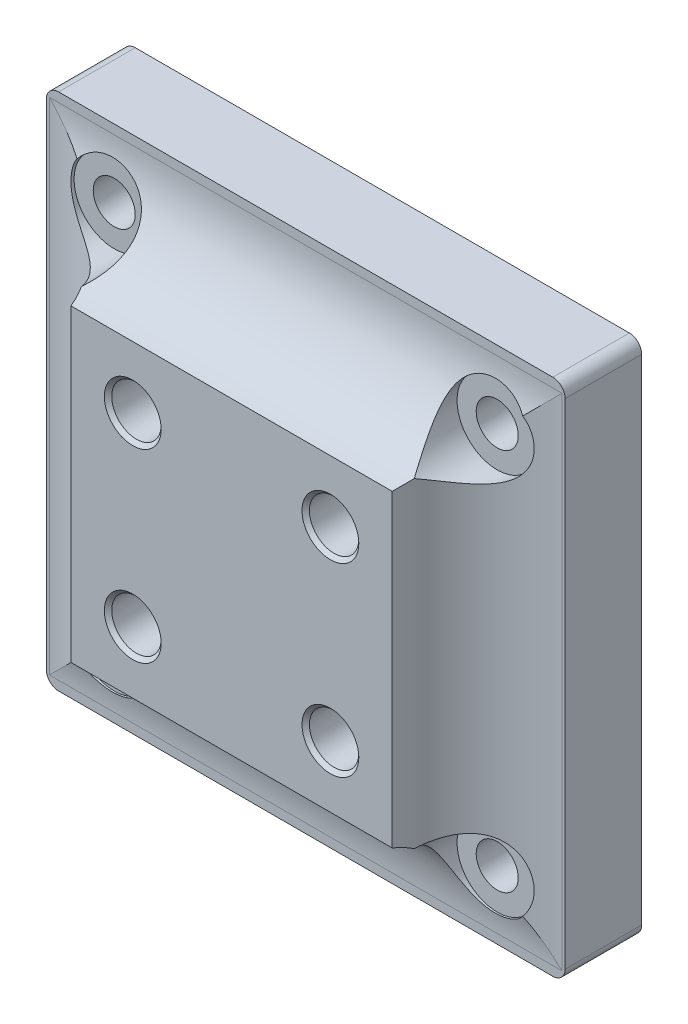
from build123d import *

# Parameters (mm, degrees)
SKETCH1_W           = 42
SKETCH1_H           = 42
SKETCH1_R           = 1.7
SKETCH1_R_2         = 3
BOSS_EXTRUDE1_DEPTH = 6.2
SKETCH2_W           = 26
SKETCH2_H           = 25
SKETCH2_R           = 2
BOSS_EXTRUDE2_DEPTH = 6
FILLET2_R           = 8
SKETCH3_R           = 3.25
CUT_EXTRUDE1_DEPTH  = 6
CHAMFER1_SIZE       = 0.3
FILLET3_R           = 1


with BuildPart() as part:
    # Sketch1 → Boss-Extrude1 (new body)
    with BuildSketch(Plane.XY):
        with Locations((21, 21)):
            Rectangle(SKETCH1_W, SKETCH1_H)
        with Locations(Location((5.5, 5.5, 0), (0, 0, 180))):
            Circle(SKETCH1_R, mode=Mode.SUBTRACT)
        with Locations(Location((36.5, 5.5, 0), (0, 0, 180))):
            Circle(SKETCH1_R, mode=Mode.SUBTRACT)
        with Locations(Location((36.5, 36.5, 0), (0, 0, 180))):
            Circle(SKETCH1_R, mode=Mode.SUBTRACT)
        with Locations(Location((5.5, 36.5, 0), (0, 0, 180))):
            Circle(SKETCH1_R, mode=Mode.SUBTRACT)
        with Locations(Location((13, 13.5, 0), (0, 0, 180))):
            Circle(SKETCH1_R_2, mode=Mode.SUBTRACT)
        with Locations(Location((29, 13.5, 0), (0, 0, 180))):
            Circle(SKETCH1_R_2, mode=Mode.SUBTRACT)
        with Locations(Location((29, 28.5, 0), (0, 0, 180))):
            Circle(SKETCH1_R_2, mode=Mode.SUBTRACT)
        with Locations(Location((13, 28.5, 0), (0, 0, 180))):
            Circle(SKETCH1_R_2, mode=Mode.SUBTRACT)
    extrude(amount=BOSS_EXTRUDE1_DEPTH)

    # Sketch2 → Boss-Extrude2 (add)
    with BuildSketch(Plane.XY.offset(6.2)):
        with Locations((21, 21)):
            Rectangle(SKETCH2_W, SKETCH2_H)
        with Locations((13, 13.5)):
            Circle(SKETCH2_R, mode=Mode.SUBTRACT)
        with Locations((29, 13.5)):
            Circle(SKETCH2_R, mode=Mode.SUBTRACT)
        with Locations((29, 28.5)):
            Circle(SKETCH2_R, mode=Mode.SUBTRACT)
        with Locations((13, 28.5)):
            Circle(SKETCH2_R, mode=Mode.SUBTRACT)
    extrude(amount=BOSS_EXTRUDE2_DEPTH)

    # Fillet2
    # the kernel refuses this fillet: 8 mm, written as the material it adds along each edge
    with BuildSketch(Plane(origin=(8, 33.5, 6.2), x_dir=(0, 1, 0), z_dir=(1, 0, 0)), Plane(origin=(34, 8.5, 6.2), x_dir=(0, -1, 0), z_dir=(-1, 0, 0))) as fillet2_piece_1:
        with BuildLine():
            CenterArc((7.745966692, 8), FILLET2_R, 194.477512186, 75.522487814)
            Line((0, 6), (-0.154919334, 5.96))
            ThreePointArc((-0.154919334, 5.96), (-0.16, 3), (-0.16, 0))
            Line((-0.16, 0), (0, -0.16))
            Line((0, -0.16), (7.745966692, -0.16))
            Line((7.745966692, -0.16), (7.745966692, 0))
        make_face()
    extrude(amount=26)
    with BuildSketch(Plane(origin=(8, 8.5, 6.2), x_dir=(-1, 0, 0), z_dir=(0, 1, 0)), Plane(origin=(34, 33.5, 6.2), x_dir=(1, 0, 0), z_dir=(0, -1, 0))) as fillet2_piece_2:
        with BuildLine():
            CenterArc((7.745966692, 8), FILLET2_R, 194.477512186, 75.522487814)
            Line((0, 6), (-0.154919334, 5.96))
            ThreePointArc((-0.154919334, 5.96), (-0.16, 3), (-0.16, 0))
            Line((-0.16, 0), (0, -0.16))
            Line((0, -0.16), (7.745966692, -0.16))
            Line((7.745966692, -0.16), (7.745966692, 0))
        make_face()
    extrude(amount=25)
    with BuildSketch(Plane(origin=(-11.364916731, 33.5, 6.2), x_dir=(0, 1, 0), z_dir=(1, 0, 0))) as fillet2_piece_3a_section:
        with BuildLine():
            CenterArc((7.745966692, 8), FILLET2_R, 194.477512186, 75.522487814)
            Line((0, 6), (-0.154919334, 5.96))
            ThreePointArc((-0.154919334, 5.96), (-0.16, 3), (-0.16, 0))
            Line((-0.16, 0), (0, -0.16))
            Line((0, -0.16), (7.745966692, -0.16))
            Line((7.745966692, -0.16), (7.745966692, 0))
        make_face()
    fillet2_piece_3a = extrude(amount=45.364916731, mode=Mode.PRIVATE)
    fillet2_piece_3a = split(fillet2_piece_3a, bisect_by=Plane(origin=(0, 35.178274385, 7.827030576), z_dir=(1, 0, 0)), keep=Keep.TOP, mode=Mode.PRIVATE)
    fillet2_piece_3a = fillet2_piece_3a - Plane(origin=(5.5, 36.5, 7.827030576), x_dir=(-1, 0, 0), z_dir=(0, 0, -1)) * Cylinder(1.7, 122, mode=Mode.PRIVATE)
    fillet2_piece_3a = split(fillet2_piece_3a, bisect_by=Plane(origin=(8, 35.178274385, 7.827030576), z_dir=(-1, 0, 0)), keep=Keep.TOP, mode=Mode.PRIVATE)
    with BuildSketch(Plane(origin=(8, 8.5, 6.2), x_dir=(-1, 0, 0), z_dir=(0, 1, 0))) as fillet2_piece_3b_section:
        with BuildLine():
            CenterArc((7.745966692, 8), FILLET2_R, 194.477512186, 75.522487814)
            Line((0, 6), (-0.154919334, 5.96))
            ThreePointArc((-0.154919334, 5.96), (-0.16, 3), (-0.16, 0))
            Line((-0.16, 0), (0, -0.16))
            Line((0, -0.16), (7.745966692, -0.16))
            Line((7.745966692, -0.16), (7.745966692, 0))
        make_face()
    fillet2_piece_3b = extrude(amount=44.364916731, mode=Mode.PRIVATE)
    fillet2_piece_3b = split(fillet2_piece_3b, bisect_by=Plane(origin=(2.007562064, 42, 6.346846355), z_dir=(0, -1, 0)), keep=Keep.TOP, mode=Mode.PRIVATE)
    fillet2_piece_3b = fillet2_piece_3b - Plane(origin=(5.5, 36.5, 6.346846355), x_dir=(-1, 0, 0), z_dir=(0, 0, -1)) * Cylinder(1.7, 120, mode=Mode.PRIVATE)
    fillet2_piece_3b = split(fillet2_piece_3b, bisect_by=Plane(origin=(2.007562064, 33.5, 6.346846355), z_dir=(0, 1, 0)), keep=Keep.TOP, mode=Mode.PRIVATE)
    fillet2_piece_3 = fillet2_piece_3a & fillet2_piece_3b
    add(fillet2_piece_3)
    with BuildSketch(Plane(origin=(34, 52.864916731, 6.2), x_dir=(1, 0, 0), z_dir=(0, -1, 0))) as fillet2_piece_4a_section:
        with BuildLine():
            CenterArc((7.745966692, 8), FILLET2_R, 194.477512186, 75.522487814)
            Line((0, 6), (-0.154919334, 5.96))
            ThreePointArc((-0.154919334, 5.96), (-0.16, 3), (-0.16, 0))
            Line((-0.16, 0), (0, -0.16))
            Line((0, -0.16), (7.745966692, -0.16))
            Line((7.745966692, -0.16), (7.745966692, 0))
        make_face()
    fillet2_piece_4a = extrude(amount=44.364916731, mode=Mode.PRIVATE)
    fillet2_piece_4a = split(fillet2_piece_4a, bisect_by=Plane(origin=(39.992437924, 42, 6.3468463), z_dir=(0, -1, 0)), keep=Keep.TOP, mode=Mode.PRIVATE)
    fillet2_piece_4a = fillet2_piece_4a - Plane(origin=(36.5, 36.5, 6.3468463), x_dir=(-1, 0, 0), z_dir=(0, 0, -1)) * Cylinder(1.7, 120, mode=Mode.PRIVATE)
    fillet2_piece_4a = split(fillet2_piece_4a, bisect_by=Plane(origin=(39.992437924, 33.5, 6.3468463), z_dir=(0, 1, 0)), keep=Keep.TOP, mode=Mode.PRIVATE)
    with BuildSketch(Plane(origin=(8, 33.5, 6.2), x_dir=(0, 1, 0), z_dir=(1, 0, 0))) as fillet2_piece_4b_section:
        with BuildLine():
            CenterArc((7.745966692, 8), FILLET2_R, 194.477512186, 75.522487814)
            Line((0, 6), (-0.154919334, 5.96))
            ThreePointArc((-0.154919334, 5.96), (-0.16, 3), (-0.16, 0))
            Line((-0.16, 0), (0, -0.16))
            Line((0, -0.16), (7.745966692, -0.16))
            Line((7.745966692, -0.16), (7.745966692, 0))
        make_face()
    fillet2_piece_4b = extrude(amount=45.364916731, mode=Mode.PRIVATE)
    fillet2_piece_4b = split(fillet2_piece_4b, bisect_by=Plane(origin=(42, 35.178274622, 7.827030822), z_dir=(-1, 0, 0)), keep=Keep.TOP, mode=Mode.PRIVATE)
    fillet2_piece_4b = fillet2_piece_4b - Plane(origin=(36.5, 36.5, 7.827030822), x_dir=(-1, 0, 0), z_dir=(0, 0, -1)) * Cylinder(1.7, 122, mode=Mode.PRIVATE)
    fillet2_piece_4b = split(fillet2_piece_4b, bisect_by=Plane(origin=(34, 35.178274622, 7.827030822), z_dir=(1, 0, 0)), keep=Keep.TOP, mode=Mode.PRIVATE)
    fillet2_piece_4 = fillet2_piece_4a & fillet2_piece_4b
    add(fillet2_piece_4)
    with BuildSketch(Plane(origin=(34, 8.5, 6.2), x_dir=(0, -1, 0), z_dir=(-1, 0, 0))) as fillet2_piece_5a_section:
        with BuildLine():
            CenterArc((7.745966692, 8), FILLET2_R, 194.477512186, 75.522487814)
            Line((0, 6), (-0.154919334, 5.96))
            ThreePointArc((-0.154919334, 5.96), (-0.16, 3), (-0.16, 0))
            Line((-0.16, 0), (0, -0.16))
            Line((0, -0.16), (7.745966692, -0.16))
            Line((7.745966692, -0.16), (7.745966692, 0))
        make_face()
    fillet2_piece_5a = extrude(amount=45.364916731, mode=Mode.PRIVATE)
    fillet2_piece_5a = split(fillet2_piece_5a, bisect_by=Plane(origin=(0, 6.821719635, 7.827028702), z_dir=(1, 0, 0)), keep=Keep.TOP, mode=Mode.PRIVATE)
    fillet2_piece_5a = fillet2_piece_5a - Plane(origin=(5.5, 5.5, 7.827028702), x_dir=(-1, 0, 0), z_dir=(0, 0, -1)) * Cylinder(1.7, 122, mode=Mode.PRIVATE)
    fillet2_piece_5a = split(fillet2_piece_5a, bisect_by=Plane(origin=(8, 6.821719635, 7.827028702), z_dir=(-1, 0, 0)), keep=Keep.TOP, mode=Mode.PRIVATE)
    with BuildSketch(Plane(origin=(8, -10.864916731, 6.2), x_dir=(-1, 0, 0), z_dir=(0, 1, 0))) as fillet2_piece_5b_section:
        with BuildLine():
            CenterArc((7.745966692, 8), FILLET2_R, 194.477512186, 75.522487814)
            Line((0, 6), (-0.154919334, 5.96))
            ThreePointArc((-0.154919334, 5.96), (-0.16, 3), (-0.16, 0))
            Line((-0.16, 0), (0, -0.16))
            Line((0, -0.16), (7.745966692, -0.16))
            Line((7.745966692, -0.16), (7.745966692, 0))
        make_face()
    fillet2_piece_5b = extrude(amount=44.364916731, mode=Mode.PRIVATE)
    fillet2_piece_5b = split(fillet2_piece_5b, bisect_by=Plane(origin=(2.007562075, 0, 6.346846306), z_dir=(0, 1, 0)), keep=Keep.TOP, mode=Mode.PRIVATE)
    fillet2_piece_5b = fillet2_piece_5b - Plane(origin=(5.5, 5.5, 6.346846306), x_dir=(-1, 0, 0), z_dir=(0, 0, -1)) * Cylinder(1.7, 120, mode=Mode.PRIVATE)
    fillet2_piece_5b = split(fillet2_piece_5b, bisect_by=Plane(origin=(2.007562075, 8.5, 6.346846306), z_dir=(0, -1, 0)), keep=Keep.TOP, mode=Mode.PRIVATE)
    fillet2_piece_5 = fillet2_piece_5a & fillet2_piece_5b
    add(fillet2_piece_5)
    with BuildSketch(Plane(origin=(53.364916731, 8.5, 6.2), x_dir=(0, -1, 0), z_dir=(-1, 0, 0))) as fillet2_piece_6a_section:
        with BuildLine():
            CenterArc((7.745966692, 8), FILLET2_R, 194.477512186, 75.522487814)
            Line((0, 6), (-0.154919334, 5.96))
            ThreePointArc((-0.154919334, 5.96), (-0.16, 3), (-0.16, 0))
            Line((-0.16, 0), (0, -0.16))
            Line((0, -0.16), (7.745966692, -0.16))
            Line((7.745966692, -0.16), (7.745966692, 0))
        make_face()
    fillet2_piece_6a = extrude(amount=45.364916731, mode=Mode.PRIVATE)
    fillet2_piece_6a = split(fillet2_piece_6a, bisect_by=Plane(origin=(42, 6.821719176, 7.827028974), z_dir=(-1, 0, 0)), keep=Keep.TOP, mode=Mode.PRIVATE)
    fillet2_piece_6a = fillet2_piece_6a - Plane(origin=(36.5, 5.5, 7.827028974), x_dir=(-1, 0, 0), z_dir=(0, 0, -1)) * Cylinder(1.7, 122, mode=Mode.PRIVATE)
    fillet2_piece_6a = split(fillet2_piece_6a, bisect_by=Plane(origin=(34, 6.821719176, 7.827028974), z_dir=(1, 0, 0)), keep=Keep.TOP, mode=Mode.PRIVATE)
    with BuildSketch(Plane(origin=(34, 33.5, 6.2), x_dir=(1, 0, 0), z_dir=(0, -1, 0))) as fillet2_piece_6b_section:
        with BuildLine():
            CenterArc((7.745966692, 8), FILLET2_R, 194.477512186, 75.522487814)
            Line((0, 6), (-0.154919334, 5.96))
            ThreePointArc((-0.154919334, 5.96), (-0.16, 3), (-0.16, 0))
            Line((-0.16, 0), (0, -0.16))
            Line((0, -0.16), (7.745966692, -0.16))
            Line((7.745966692, -0.16), (7.745966692, 0))
        make_face()
    fillet2_piece_6b = extrude(amount=44.364916731, mode=Mode.PRIVATE)
    fillet2_piece_6b = split(fillet2_piece_6b, bisect_by=Plane(origin=(39.992437924, 0, 6.346846301), z_dir=(0, 1, 0)), keep=Keep.TOP, mode=Mode.PRIVATE)
    fillet2_piece_6b = fillet2_piece_6b - Plane(origin=(36.5, 5.5, 6.346846301), x_dir=(-1, 0, 0), z_dir=(0, 0, -1)) * Cylinder(1.7, 120, mode=Mode.PRIVATE)
    fillet2_piece_6b = split(fillet2_piece_6b, bisect_by=Plane(origin=(39.992437924, 8.5, 6.346846301), z_dir=(0, -1, 0)), keep=Keep.TOP, mode=Mode.PRIVATE)
    fillet2_piece_6 = fillet2_piece_6a & fillet2_piece_6b
    add(fillet2_piece_6)

    # Sketch3 → Cut-Extrude1 (cut)
    with BuildSketch(Plane.XY.offset(12.2)):
        with Locations(Location((5.5, 36.5, 0), (0, 0, 308.754695823))):
            Circle(SKETCH3_R)
        with Locations(Location((36.5, 36.5, 0), (0, 0, 38.75469718))):
            Circle(SKETCH3_R)
        with Locations(Location((36.5, 5.5, 0), (0, 0, 321.245329586))):
            Circle(SKETCH3_R)
        with Locations(Location((5.5, 5.5, 0), (0, 0, 51.245317663))):
            Circle(SKETCH3_R)
    extrude(amount=-CUT_EXTRUDE1_DEPTH, mode=Mode.SUBTRACT)

    # Chamfer1
    chamfer1_edges = [part.edges().sort_by_distance(p)[0] for p in [
        (11, 13.5, 12.2),
        (27, 13.5, 12.2),
        (27, 28.5, 12.2),
        (11, 28.5, 12.2),
    ]]
    chamfer(chamfer1_edges, length=CHAMFER1_SIZE)

    # Fillet3
    fillet3_edges = [part.edges().sort_by_distance(p)[0] for p in [
        (0, 42, 3.1),
        (42, 42, 3.1),
        (42, 0, 3.1),
        (0, 0, 3.1),
    ]]
    fillet(fillet3_edges, radius=FILLET3_R)


solid = part.part
